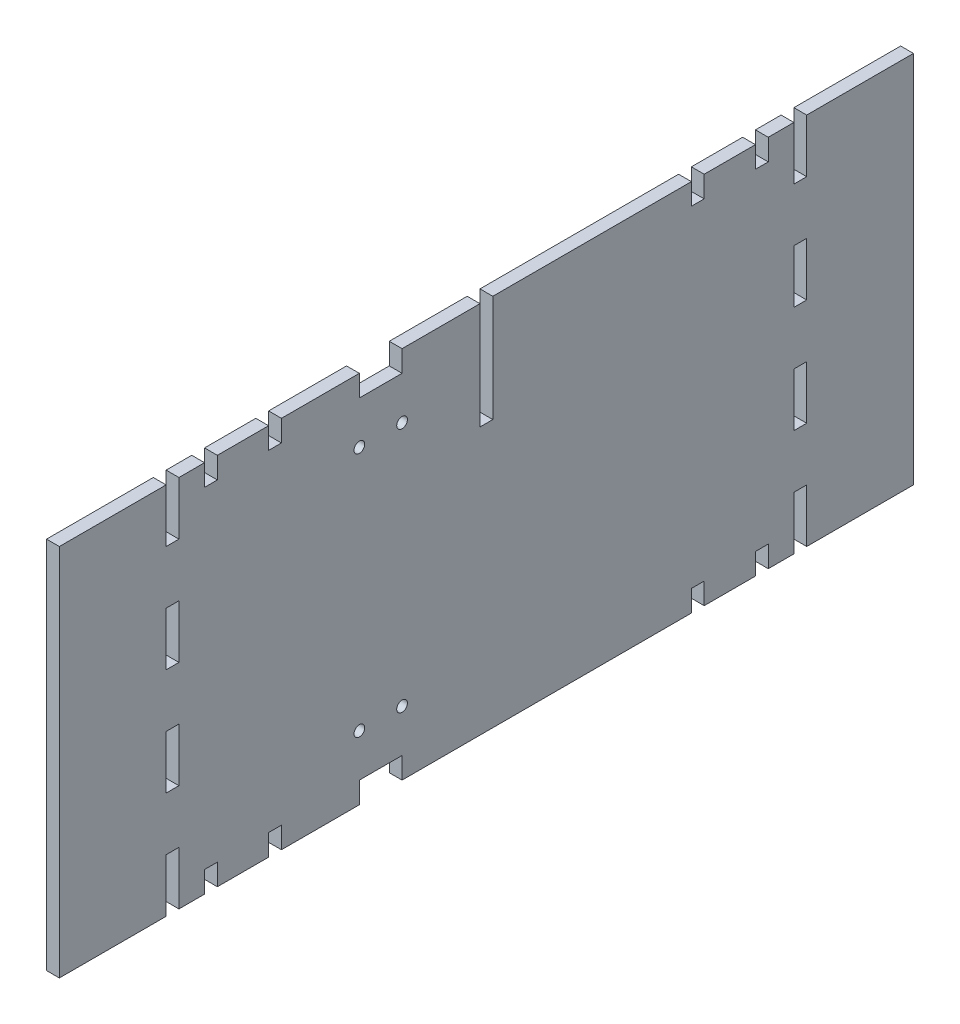
from build123d import *

# Parameters (mm, degrees)
SKETCH1_W            = 400
SKETCH1_H            = 175
BOSS_EXTRUDE1_DEPTH  = 6
SKETCH3_W            = 6
SKETCH3_H            = 25
CUT_EXTRUDE1_DEPTH   = 437.647455048
LPATTERN1_COUNT      = 2
LPATTERN1_PITCH      = 294
LPATTERN1_COUNT_DIR2 = 4
LPATTERN1_PITCH_DIR2 = 50
SKETCH4_W            = 6
SKETCH4_H            = 10
CUT_EXTRUDE2_DEPTH   = 437.647455048
LPATTERN2_COUNT      = 2
LPATTERN2_PITCH      = 258
LPATTERN2_COUNT_DIR2 = 2
LPATTERN2_PITCH_DIR2 = 165
SKETCH5_W            = 6
SKETCH5_H            = 10
CUT_EXTRUDE3_DEPTH   = 437.647455048
LPATTERN3_COUNT      = 2
LPATTERN3_PITCH      = 165
LPATTERN3_COUNT_DIR2 = 2
LPATTERN3_PITCH_DIR2 = 198
SKETCH6_W            = 6
SKETCH6_H            = 50
CUT_EXTRUDE4_DEPTH   = 10
SKETCH7_W            = 20
SKETCH7_H            = 10
CUT_EXTRUDE5_DEPTH   = 10
LPATTERN4_COUNT      = 2
LPATTERN4_PITCH      = 165
SKETCH8_R            = 2.5
CUT_EXTRUDE6_DEPTH   = 10


with BuildPart() as part:
    # Sketch1 → Boss-Extrude1 (new body)
    with BuildSketch(Plane(origin=(0, 0, 0), x_dir=(0, 0, -1), z_dir=(1, 0, 0))):
        with Locations((-200, 87.5)):
            Rectangle(SKETCH1_W, SKETCH1_H)
    extrude(amount=BOSS_EXTRUDE1_DEPTH)

    # Sketch3 → Cut-Extrude1 (cut, through all)
    with BuildSketch(Plane(origin=(6, 0, 0), x_dir=(0, 0, -1), z_dir=(1, 0, 0))):
        with Locations((-347, 162.5)):
            Rectangle(SKETCH3_W, SKETCH3_H)
    cut_extrude1 = extrude(amount=-CUT_EXTRUDE1_DEPTH, mode=Mode.SUBTRACT)

    # LPattern1: Cut-Extrude1 2 × 4
    with Locations(*[(0, -j * LPATTERN1_PITCH_DIR2, -i * LPATTERN1_PITCH) for i in range(LPATTERN1_COUNT) for j in range(LPATTERN1_COUNT_DIR2) if (i, j) != (0, 0)]):
        add(cut_extrude1, mode=Mode.SUBTRACT)

    # Sketch4 → Cut-Extrude2 (cut, through all)
    with BuildSketch(Plane(origin=(6, 0, 0), x_dir=(0, 0, -1), z_dir=(1, 0, 0))):
        with Locations((-329, 170)):
            Rectangle(SKETCH4_W, SKETCH4_H)
    cut_extrude2 = extrude(amount=-CUT_EXTRUDE2_DEPTH, mode=Mode.SUBTRACT)

    # LPattern2: Cut-Extrude2 2 × 2
    with Locations(*[(0, -j * LPATTERN2_PITCH_DIR2, -i * LPATTERN2_PITCH) for i in range(LPATTERN2_COUNT) for j in range(LPATTERN2_COUNT_DIR2) if (i, j) != (0, 0)]):
        add(cut_extrude2, mode=Mode.SUBTRACT)

    # Sketch5 → Cut-Extrude3 (cut, through all)
    with BuildSketch(Plane(origin=(6, 0, 0), x_dir=(0, 0, -1), z_dir=(1, 0, 0))):
        with Locations((-299, 170)):
            Rectangle(SKETCH5_W, SKETCH5_H)
    cut_extrude3 = extrude(amount=-CUT_EXTRUDE3_DEPTH, mode=Mode.SUBTRACT)

    # LPattern3: Cut-Extrude3 2 × 2
    with Locations(*[(0, -i * LPATTERN3_PITCH, -j * LPATTERN3_PITCH_DIR2) for i in range(LPATTERN3_COUNT) for j in range(LPATTERN3_COUNT_DIR2) if (i, j) != (0, 0)]):
        add(cut_extrude3, mode=Mode.SUBTRACT)

    # Sketch6 → Cut-Extrude4 (cut)
    with BuildSketch(Plane(origin=(6, 0, 0), x_dir=(0, 0, -1), z_dir=(1, 0, 0))):
        with Locations((-200, 150)):
            Rectangle(SKETCH6_W, SKETCH6_H)
    extrude(amount=-CUT_EXTRUDE4_DEPTH, mode=Mode.SUBTRACT)

    # Sketch7 → Cut-Extrude5 (cut)
    with BuildSketch(Plane(origin=(6, 0, 0), x_dir=(0, 0, -1), z_dir=(1, 0, 0))):
        with Locations((-249.5, 170)):
            Rectangle(SKETCH7_W, SKETCH7_H)
    cut_extrude5 = extrude(amount=-CUT_EXTRUDE5_DEPTH, mode=Mode.SUBTRACT)

    # LPattern4: Cut-Extrude5 ×2
    with Locations(*[(0, -i * LPATTERN4_PITCH, 0) for i in range(1, LPATTERN4_COUNT)]):
        add(cut_extrude5, mode=Mode.SUBTRACT)

    # Sketch8 → Cut-Extrude6 (cut)
    with BuildSketch(Plane(origin=(6, 0, 0), x_dir=(0, 0, -1), z_dir=(1, 0, 0))):
        with Locations((-259.5, 145)):
            Circle(SKETCH8_R)
        with Locations((-239.5, 145)):
            Circle(SKETCH8_R)
        with Locations((-259.5, 30)):
            Circle(SKETCH8_R)
        with Locations((-239.5, 30)):
            Circle(SKETCH8_R)
    extrude(amount=-CUT_EXTRUDE6_DEPTH, mode=Mode.SUBTRACT)


solid = part.part
